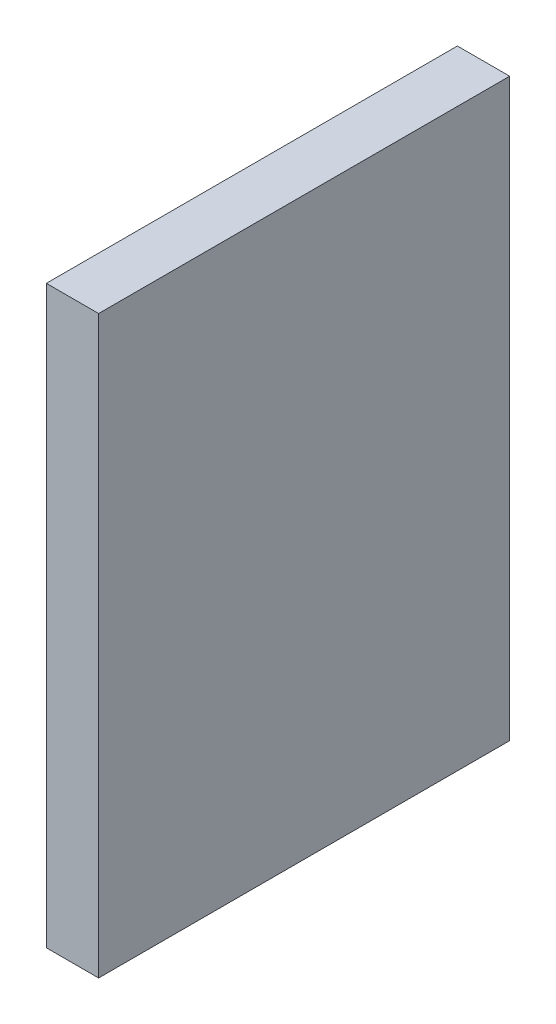
from build123d import *

# Parameters (mm, degrees)
BOSS_EXTRU_1_DEPTH               = 5
ENL_V_MAT_EXTRU_2_DEPTH          = 30
R_P_TITION_START                 = -13.698729417
R_P_TITION_LIN_AIRE1_OUTLINE_W   = 17
R_P_TITION_LIN_AIRE1_OUTLINE_H   = 5
R_P_TITION_LIN_AIRE1_DEPTH       = 167.693647085
R_P_TITION_START_2               = 86.498729417
R_P_TITION_LIN_AIRE1_2_OUTLINE_W = 7
R_P_TITION_LIN_AIRE1_2_OUTLINE_H = 5
R_P_TITION_LIN_AIRE1_2_DEPTH     = 67.496188251
R_P_TITION_LIN_AIRE1_3_OUTLINE_W = 7
R_P_TITION_LIN_AIRE1_3_OUTLINE_H = 5
R_P_TITION_LIN_AIRE1_3_DEPTH     = 63.161305733


# Read off the part's stored shape, not the designer's step: Répétition linéaire1
with BuildPart() as part:
    # Esquisse1 → Boss.-Extru.1 (new body)
    with BuildSketch(Plane.XY):
        with BuildLine():
            Line((-13.698729417, 0), (0, 0))
            Line((0, 0), (0, 19))
            Line((0, 19), (36.4, 19))
            Line((36.4, 19), (36.4, 0))
            Line((36.4, 0), (50.098729417, 0))
            Line((50.098729417, 0), (50.098729417, 19))
            Line((50.098729417, 19), (86.498729417, 19))
            Line((86.498729417, 19), (86.498729417, 0))
            Line((86.498729417, 0), (103.896188251, 0))
            Line((103.896188251, 0), (103.896188251, 19))
            Line((103.896188251, 19), (140.296188251, 19))
            Line((140.296188251, 19), (140.296188251, 0))
            Line((140.296188251, 0), (153.994917668, 0))
            Line((153.994917668, 0), (153.994917668, 19))
            Line((153.994917668, 19), (153.994917668, 24))
            Line((153.994917668, 24), (-8.698729417, 24))
            ThreePointArc((-8.698729417, 24), (-12.234263323, 22.535533906), (-13.698729417, 19))
            Line((-13.698729417, 19), (-13.698729417, 0))
        make_face()
    extrude(amount=BOSS_EXTRU_1_DEPTH)

    # Esquisse3 → Enlèv. mat.-Extru.2 (cut)
    with BuildSketch(Plane.XY.offset(5)):
        Polygon((-3.537423684, 3.002605055), (-3.537423684, 7), (-2.537423684, 7), (-2.537423684, 9), (-3.537423684, 9), (-3.537423684, 18), (-6.537423684, 18), (-6.537423684, 9), (-7.537423684, 9), (-7.537423684, 7), (-6.537423684, 7), (-6.537423684, 3.002605055), (-6.537423684, 0), (-3.537423684, 0), align=None)
    extrude(amount=-ENL_V_MAT_EXTRU_2_DEPTH, mode=Mode.SUBTRACT)

    # Répétition linéaire1 outline → Répétition linéaire1 (cut)
    with BuildSketch(Plane.YZ.offset(R_P_TITION_START)):
        with Locations((15.5, 2.5)):
            Rectangle(R_P_TITION_LIN_AIRE1_OUTLINE_W, R_P_TITION_LIN_AIRE1_OUTLINE_H)
    extrude(amount=R_P_TITION_LIN_AIRE1_DEPTH, mode=Mode.SUBTRACT)

    # R_p_tition lin_aire1 2 outline → R_p_tition lin_aire1 2 (cut)
    with BuildSketch(Plane.YZ.offset(R_P_TITION_START_2)):
        with Locations((3.5, 2.5)):
            Rectangle(R_P_TITION_LIN_AIRE1_2_OUTLINE_W, R_P_TITION_LIN_AIRE1_2_OUTLINE_H)
    extrude(amount=R_P_TITION_LIN_AIRE1_2_DEPTH, mode=Mode.SUBTRACT)

    # R_p_tition lin_aire1 3 outline → R_p_tition lin_aire1 3 (cut)
    with BuildSketch(Plane.YZ.offset(R_P_TITION_START)):
        with Locations((3.5, 2.5)):
            Rectangle(R_P_TITION_LIN_AIRE1_3_OUTLINE_W, R_P_TITION_LIN_AIRE1_3_OUTLINE_H)
    extrude(amount=R_P_TITION_LIN_AIRE1_3_DEPTH, mode=Mode.SUBTRACT)


solid = part.part
